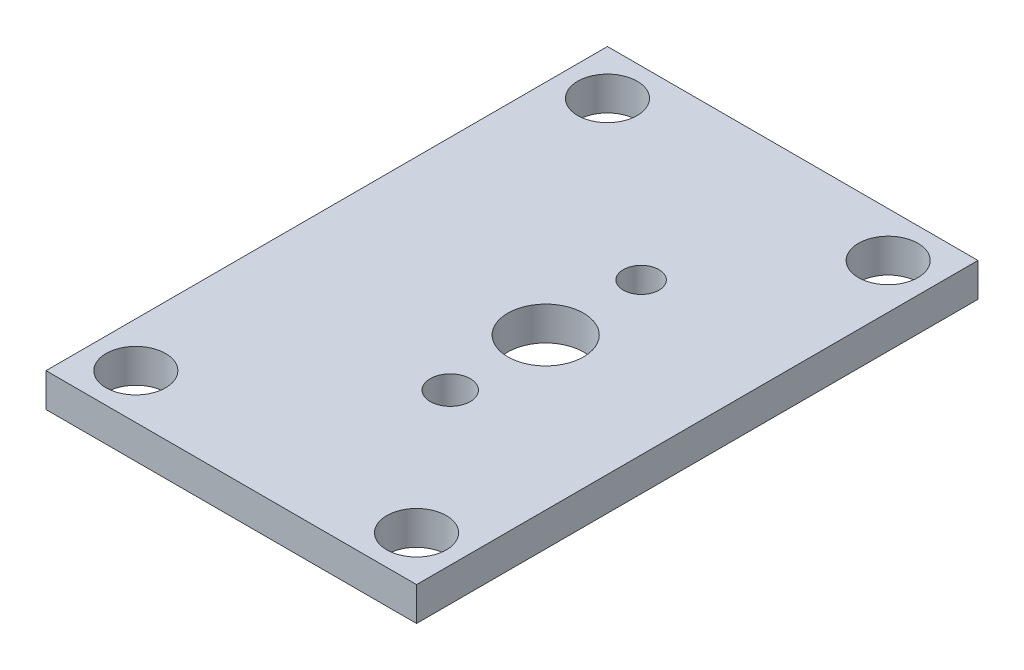
from build123d import *

# Parameters (mm, degrees)
SKETCH1_W           = 25
SKETCH1_H           = 50
SKETCH1_R           = 3.375
BOSS_EXTRUDE1_DEPTH = 3
SKETCH2_W           = 50
SKETCH2_H           = 3
BOSS_EXTRUDE2_DEPTH = 8
SKETCH3_W           = 8
SKETCH3_H           = 50
BOSS_EXTRUDE3_DEPTH = 42
SKETCH4_R           = 2.65
CUT_EXTRUDE1_DEPTH  = 3.3
SKETCH5_R           = 5.802370205
CUT_EXTRUDE2_DEPTH  = 9
FILLET2_R           = 1
SKETCH6_R           = 12.7
BOSS_EXTRUDE4_DEPTH = 2
FILLET4_R           = 1
SKETCH8_R           = 1.589780168
SKETCH8_R_2         = 1.777428262
CUT_EXTRUDE3_DEPTH  = 10
SKETCH9_W           = 8
SKETCH9_H           = 42
CUT_EXTRUDE4_DEPTH  = 68.79439129
SKETCH10_W          = 33.517939775
SKETCH10_H          = 6.212330843
CUT_EXTRUDE5_DEPTH  = 55


with BuildPart() as part:
    # Sketch1 → Boss-Extrude1 (new body)
    with BuildSketch(Plane(origin=(0, 0, 0), x_dir=(1, 0, 0), z_dir=(0, 1, 0))):
        with Locations((2.276951673, 11.384758364)):
            Rectangle(SKETCH1_W, SKETCH1_H)
        with Locations(Location((1.276951673, 11.384758364, 0), (0, 0, 270))):
            Circle(SKETCH1_R, mode=Mode.SUBTRACT)
    extrude(amount=BOSS_EXTRUDE1_DEPTH)

    # Sketch2 → Boss-Extrude2 (add)
    with BuildSketch(Plane.ZY.offset(10.223048327)):
        with Locations((-11.384758364, 1.5)):
            Rectangle(SKETCH2_W, SKETCH2_H)
    extrude(amount=BOSS_EXTRUDE2_DEPTH)

    # Sketch3 → Boss-Extrude3 (add)
    with BuildSketch(Plane.XZ):
        with Locations((-14.223048327, -11.384758364)):
            Rectangle(SKETCH3_W, SKETCH3_H)
    extrude(amount=BOSS_EXTRUDE3_DEPTH)

    # Sketch4 → Cut-Extrude1 (cut)
    with BuildSketch(Plane(origin=(0, 3, 0), x_dir=(1, 0, 0), z_dir=(0, 1, 0))):
        with Locations(Location((-14.223048327, 32.384758364, 0), (0, 0, 270))):
            Circle(SKETCH4_R)
        with Locations(Location((-14.223048327, -9.615241636, 0), (0, 0, 270))):
            Circle(SKETCH4_R)
    cut_extrude1 = extrude(amount=-CUT_EXTRUDE1_DEPTH, mode=Mode.SUBTRACT)

    # Mirror1: Cut-Extrude1 across plane
    add(cut_extrude1.mirror(Plane.ZX.offset(-19.5)), mode=Mode.SUBTRACT)

    # Sketch5 → Cut-Extrude2 (cut)
    with BuildSketch(Plane.ZY.offset(18.223048327)):
        with Locations((-11.836279124, -21)):
            Circle(SKETCH5_R)
    extrude(amount=-CUT_EXTRUDE2_DEPTH, mode=Mode.SUBTRACT)

    # Fillet2
    fillet2_edges = [part.edges().sort_by_distance(p)[0] for p in [
        (-10.223048327, -21, -17.638649329),
    ]]
    fillet(fillet2_edges, radius=FILLET2_R)

    # Mirror2: Cut-Extrude1 across plane
    add(cut_extrude1.mirror(Plane.ZY.offset(1.723048327)), mode=Mode.SUBTRACT)

    # Sketch6 → Boss-Extrude4 (add)
    with BuildSketch(Plane(origin=(0, 3, 0), x_dir=(1, 0, 0), z_dir=(0, 1, 0))):
        with BuildLine():
            Line((14.776951673, 5.567542535), (14.776951673, 17.201974193))
            ThreePointArc((14.776951673, 17.201974193), (-13.423048327, 11.384758364), (14.776951673, 5.567542535))
        make_face()
        with Locations(Location((1.276951673, 11.384758364, 0), (0, 0, 270))):
            Circle(SKETCH6_R, mode=Mode.SUBTRACT)
    extrude(amount=BOSS_EXTRUDE4_DEPTH)

    # Fillet4
    # the kernel refuses this fillet: 1 mm, written as the material it takes off along each edge
    with BuildSketch(Plane(origin=(14.776951673, 5, -3.067542535), x_dir=(0, -1, 0), z_dir=(0, 0, -1))) as fillet4_piece_1:
        with BuildLine():
            CenterArc((FILLET4_R, FILLET4_R), FILLET4_R, 180, 90)
            Line((0, FILLET4_R), (0, 0))
            Line((0, 0), (FILLET4_R, 0))
        make_face()
    extrude(amount=16.634431658, mode=Mode.SUBTRACT)

    # Sketch8 → Cut-Extrude3 (cut)
    with BuildSketch(Plane(origin=(0, 3, 0), x_dir=(1, 0, 0), z_dir=(0, 1, 0))):
        with Locations(Location((1.276951673, 19.884758364, 0), (0, 0, 270))):
            Circle(SKETCH8_R)
        with Locations(Location((1.276951673, 2.884758364, 0), (0, 0, 270))):
            Circle(SKETCH8_R_2)
    extrude(amount=-CUT_EXTRUDE3_DEPTH, mode=Mode.SUBTRACT)

    # Sketch9 → Cut-Extrude4 (cut, through all)
    with BuildSketch(Plane.XY.offset(13.615241636)):
        with Locations((-14.223048327, -21)):
            Rectangle(SKETCH9_W, SKETCH9_H)
    extrude(amount=-CUT_EXTRUDE4_DEPTH, mode=Mode.SUBTRACT)

    # Sketch10 → Cut-Extrude5 (cut)
    with BuildSketch(Plane.XY.offset(13.615241636)):
        with Locations((-1.464078439, 6.106165422)):
            Rectangle(SKETCH10_W, SKETCH10_H)
    extrude(amount=-CUT_EXTRUDE5_DEPTH, mode=Mode.SUBTRACT)


solid = part.part
